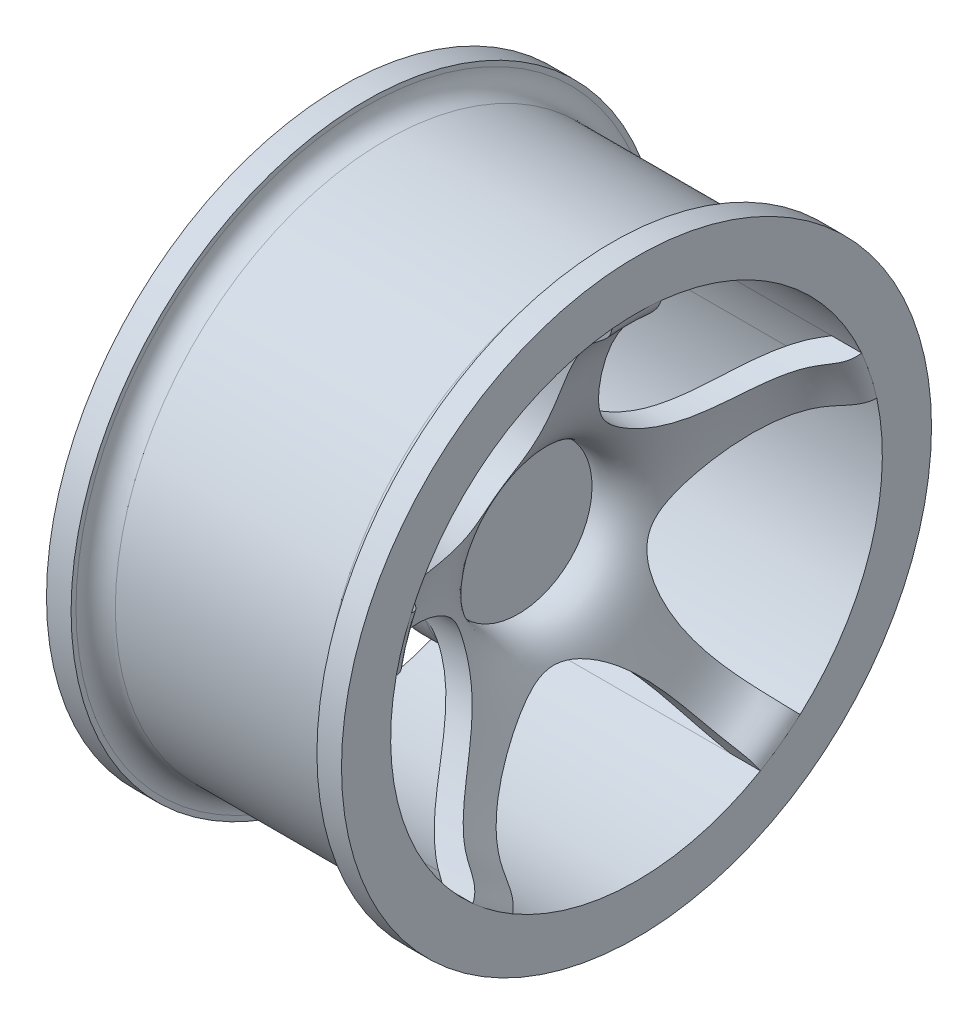
from build123d import *

# Parameters (mm, degrees)
SKETCH14_R          = 19.05
SKETCH14_R_2        = 12.7
BOSS_EXTRUDE4_DEPTH = 31.75
SKETCH15_R          = 19.05
BOSS_EXTRUDE5_DEPTH = 7.62
CUT_EXTRUDE1_DEPTH  = 132.982271537
CIRPATTERN1_START   = -38.1
CIRPATTERN1_DEPTH   = 76.2


# Read off the part's stored shape, not the designer's step: CirPattern1
with BuildPart() as part:
    # Sketch1 → Revolve1 (revolve)
    with BuildSketch(Plane.XY, mode=Mode.PRIVATE) as revolve1_sk:
        with BuildLine():
            Line((-26.67, 69.85), (26.67, 69.85))
            ThreePointArc((26.67, 69.85), (30.262102448, 71.337897552), (31.75, 74.93))
            Line((31.75, 74.93), (31.75, 76.2))
            Line((31.75, 76.2), (38.1, 76.2))
            Line((38.1, 76.2), (38.1, 63.5))
            add(Edge.make_bspline(
                [(7.565895982, 19.05), (22.428246791, 19.049979514), (19.929617482, 51.803729755), (37.352125696, 60.198607754), (38.1, 63.5)],
                knots=[0, 0, 0, 0, 0.823077224, 1, 1, 1, 1], degree=3))
            Line((7.565895982, 19.05), (7.565895982, 12.7))
            Line((7.565895982, 12.7), (0, 12.7))
            Line((0, 12.7), (-6.35, 12.7))
            Line((-6.35, 12.7), (-6.35, 19.05))
            Line((-6.35, 19.05), (0, 19.05))
            Line((0, 19.05), (0, 25.4))
            Line((0, 25.4), (7.565904735, 25.4))
            add(Edge.make_bspline(
                [(7.565904735, 25.4), (7.688316268, 25.399999831), (7.945411521, 25.408689923), (8.3598295, 25.453346667), (8.783215641, 25.547573146), (9.197103371, 25.706534948), (9.732698048, 26.004890046), (10.508402097, 26.652469206), (11.643761126, 28.145829502), (12.83447991, 30.359343459), (14.401764333, 34.104519092), (15.917194655, 38.745388995), (17.580115444, 43.78623859), (18.987152235, 47.66965377), (20.651694077, 51.564125239), (22.359088216, 54.747046508), (23.99536773, 57.199945499), (25.383653588, 58.975667577), (26.680547902, 60.372483441), (27.837407762, 61.443629088), (28.939742312, 62.37211099), (29.784597698, 63.026299778), (30.288317258, 63.42359483), (30.384488758, 63.5)],
                knots=[0, 0, 0, 0, 0.015062251, 0.030124503, 0.060249005, 0.090373508, 0.12049801, 0.180747015, 0.240996021, 0.301245026, 0.361494031, 0.481992041, 0.542241046, 0.602490052, 0.662739057, 0.722988062, 0.753112565, 0.783237067, 0.81336157, 0.828423821, 0.843486072, 0.873745441, 0.881276566, 0.881276566, 0.881276566, 0.881276566], degree=3))
            Line((30.384488758, 63.5), (0, 63.5))
            Line((0, 63.5), (-38.1, 63.5))
            Line((-38.1, 63.5), (-38.1, 76.2))
            Line((-38.1, 76.2), (-31.75, 76.2))
            Line((-31.75, 76.2), (-31.75, 74.93))
            ThreePointArc((-31.75, 74.93), (-30.262102448, 71.337897552), (-26.67, 69.85))
        make_face()
    revolve(revolve1_sk.sketch.rotate(Axis((0, 0, 0), (1, 0, 0)), 90), axis=Axis((0, 0, 0), (1, 0, 0)))

    # Sketch14 → Boss-Extrude4 (add)
    with BuildSketch(Plane.ZY.offset(38.1)):
        Circle(SKETCH14_R)
        Circle(SKETCH14_R_2, mode=Mode.SUBTRACT)
    extrude(amount=-BOSS_EXTRUDE4_DEPTH)

    # Sketch15 → Boss-Extrude5 (add)
    with BuildSketch(Plane(origin=(7.565895982, 0, 0), x_dir=(0, 0, -1), z_dir=(1, 0, 0))):
        with Locations(Location((0, 0, 0), (0, 0, 180))):
            Circle(SKETCH15_R)
    extrude(amount=-BOSS_EXTRUDE5_DEPTH)

    # Sketch16 → Cut-Extrude1 (cut, through all)
    with BuildSketch(Plane(origin=(38.1, 0, 0), x_dir=(0, 0, -1), z_dir=(1, 0, 0))):
        with BuildLine():
            ThreePointArc((-6.35, 63.181702256), (-37.327846085, 51.370582175), (-58.130324784, 25.55612139))
            add(Edge.make_bspline(
                [(-58.130324784, 25.55612139), (3.708898318, -2.491575265), (-6.35, 63.181702256)],
                knots=[0, 0, 0, 1, 1, 1], degree=2))
        make_face()
    extrude(amount=-CUT_EXTRUDE1_DEPTH, mode=Mode.SUBTRACT)

    # CirPattern1 outline → CirPattern1 (cut)
    with BuildSketch(Plane.YZ.offset(CIRPATTERN1_START)):
        with BuildLine():
            add(Edge.make_bspline(
                [(-47.38794836, 42.268574026), (2.757432814, -3.515741502), (13.485010852, 62.051627556)],
                knots=[0, 0, 0, 1, 1, 1], degree=2))
            ThreePointArc((13.485010852, 62.051627556), (-19.626508355, 60.391265727), (-47.38794836, 42.268574026))
        make_face()
        with BuildLine():
            add(Edge.make_bspline(
                [(63.1825, -6.342057533), (-4.297311013, 1.22351628), (25.563428609, -58.127111727)],
                knots=[0, 0, 0, 1, 1, 1], degree=2))
            ThreePointArc((25.563428609, -58.127111727), (51.375274162, -37.32138812), (63.1825, -6.342057533))
        make_face()
        with BuildLine():
            add(Edge.make_bspline(
                [(13.492811104, -62.049931898), (-0.164309002, 4.465072965), (-47.382634507, -42.274530715)],
                knots=[0, 0, 0, 1, 1, 1], degree=2))
            ThreePointArc((-47.382634507, -42.274530715), (-19.618916562, -60.393732451), (13.492811104, -62.049931898))
        make_face()
        with BuildLine():
            add(Edge.make_bspline(
                [(-54.843484134, -32.00690938), (4.195762466, 1.536050574), (-54.847507211, 32.000014887)],
                knots=[0, 0, 0, 1, 1, 1], degree=2))
            ThreePointArc((-54.847507211, 32.000014887), (-63.500431419, -0.003991242), (-54.843484134, -32.00690938))
        make_face()
    extrude(amount=CIRPATTERN1_DEPTH, mode=Mode.SUBTRACT)


solid = part.part
